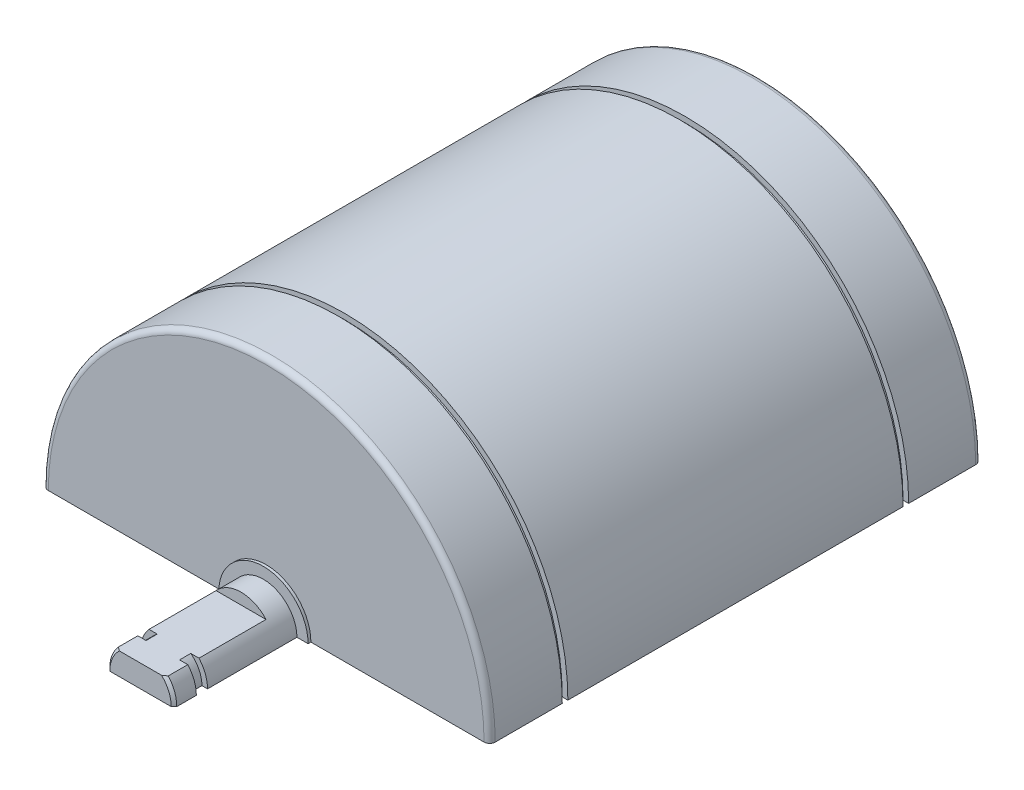
from build123d import *

# Parameters (mm, degrees)
ENL_V_MAT_EXTRU_2_DEPTH = 9
CHANFREIN1_SIZE         = 0.25
CONG_1_R                = 0.5
ESQUISSE4_R             = 10
ENL_V_MAT_EXTRU_3_DEPTH = 23
CONG_2_R                = 1
ESQUISSE5_W             = 75.40554743
ESQUISSE5_H             = 27.453522384
ENL_V_MAT_EXTRU_4_DEPTH = 30
COQUE1_START            = -43
COQUE1_DEPTH            = 42
COQUE1_START_2          = -36
COQUE1_2_DEPTH          = 28
COQUE1_START_3          = -48
COQUE1_3_DEPTH          = 5
COQUE1_4_DEPTH          = 4.5
COQUE1_START_4          = -5.5
COQUE1_5_DEPTH          = 4.5
COQUE1_START_5          = -1
COQUE1_6_DEPTH          = 8.25
COQUE1_START_6          = -43.25
COQUE1_7_DEPTH          = 0.25
COQUE1_START_7          = 7.25
COQUE1_8_DEPTH          = 3
COQUE1_9_DEPTH          = 2.25
COQUE1_10_DEPTH         = 0.25
ENL_V_START             = -10
ENL_V_MAT_EXTRU_5_DEPTH = 10
BOSS_EXTRU_1_REACH      = 58.577
BOSS_EXTRU_1_END_RADIUS = 7.5
ESQUISSE7_R             = 2.5
ESQUISSE9_R             = 2.25
ENL_V_MAT_EXTRU_6_DEPTH = 7
D_GAGEMENT_M22_D        = 2.4
BOSS_EXTRU_2_START      = 1
ESQUISSE11_R            = 2.5
ESQUISSE11_R_2          = 1.5
BOSS_EXTRU_2_DEPTH      = 1
ESQUISSE12_R            = 1.5
ESQUISSE12_R_2          = 1.2
ENL_V_MAT_EXTRU_7_DEPTH = 1


# Read off the part's stored shape, not the designer's step: Coque1
with BuildPart() as part:
    # Esquisse1 → Révolution1 (revolve)
    with BuildSketch(Plane(origin=(0, 0, 0), x_dir=(1, 0, 0), z_dir=(0, 1, 0))):
        Polygon((20, 0), (4, 0), (4, -0.25), (3, -0.25), (3, -8.25), (2.5, -8.25), (2.5, -9.25), (3, -9.25), (3, -11.25), (0, -11.25), (0, 49), (8.5, 49), (8.5, 44.25), (10, 44.25), (10, 44), (20, 44), (20, 37.5), (19.5, 37.5), (19.5, 37), (20, 37), (20, 7), (19.5, 7), (19.5, 6.5), (20, 6.5), align=None)
    revolve(axis=Axis((0, 0, 0), (0, 0, -1)))

    # Esquisse3 → Enlèv. mat.-Extru.2 (cut)
    with BuildSketch(Plane.XY.offset(11.25)):
        with BuildLine():
            Line((-2.236067977, 2), (2.236067977, 2))
            ThreePointArc((2.236067977, 2), (0, 3), (-2.236067977, 2))
        make_face()
    extrude(amount=-ENL_V_MAT_EXTRU_2_DEPTH, mode=Mode.SUBTRACT)

    # Chanfrein1
    chanfrein1_edges = [part.edges().sort_by_distance(p)[0] for p in [
        (0, -3, 11.25),
    ]]
    chamfer(chanfrein1_edges, length=CHANFREIN1_SIZE)

    # Congé1
    cong_1_edges = [part.edges().sort_by_distance(p)[0] for p in [
        (-20, 0, 0),
        (-20, 0, -44),
    ]]
    fillet(cong_1_edges, radius=CONG_1_R)

    # Esquisse4 → Enlèv. mat.-Extru.3 (cut)
    with BuildSketch(Plane(origin=(0, -29, 0), x_dir=(-1, 0, 0), z_dir=(0, 1, 0))):
        with Locations(Location((0, -22, 0), (0, 0, 270))):
            Circle(ESQUISSE4_R)
    extrude(amount=ENL_V_MAT_EXTRU_3_DEPTH, mode=Mode.SUBTRACT)

    # Congé2
    cong_2_edges = [part.edges().sort_by_distance(p)[0] for p in [
        (-0.062948247, -19.999900935, -12.000198118),
    ]]
    fillet(cong_2_edges, radius=CONG_2_R - 0.0001)  # a hair under: the kernel refuses the full size

    # Esquisse5 → Enlèv. mat.-Extru.4 (cut, symmetric)
    with BuildSketch(Plane(origin=(0, 0, 0), x_dir=(0, 0, -1), z_dir=(1, 0, 0))):
        with Locations((20.552947191, -13.726761192)):
            Rectangle(ESQUISSE5_W, ESQUISSE5_H)
    extrude(amount=ENL_V_MAT_EXTRU_4_DEPTH, both=True, mode=Mode.SUBTRACT)

    # Coque1 outline → Coque1 (cut)
    with BuildSketch(Plane.XY.offset(COQUE1_START)):
        with BuildLine():
            ThreePointArc((18.5, 0), (0, 18.5), (-18.5, 0))
            Line((-18.5, 0), (18.5, 0))
        make_face()
    extrude(amount=COQUE1_DEPTH, mode=Mode.SUBTRACT)

    # Coque1 2 outline → Coque1 2 (cut)
    with BuildSketch(Plane.XY.offset(COQUE1_START_2)):
        with BuildLine():
            Line((-19, 0), (-18.5, 0))
            ThreePointArc((-18.5, 0), (0, 18.5), (18.5, 0))
            Line((18.5, 0), (19, 0))
            ThreePointArc((19, 0), (0, 19), (-19, 0))
        make_face()
    extrude(amount=COQUE1_2_DEPTH, mode=Mode.SUBTRACT)

    # Coque1 3 outline → Coque1 3 (cut)
    with BuildSketch(Plane.XY.offset(COQUE1_START_3)):
        with BuildLine():
            ThreePointArc((7.5, 0), (0, 7.5), (-7.5, 0))
            Line((-7.5, 0), (7.5, 0))
        make_face()
    extrude(amount=COQUE1_3_DEPTH, mode=Mode.SUBTRACT)

    # Coque1 4 outline → Coque1 4 (cut)
    with BuildSketch(Plane.XY.offset(COQUE1_START)):
        with BuildLine():
            Line((-19, 0), (-18.5, 0))
            ThreePointArc((-18.5, 0), (0, 18.5), (18.5, 0))
            Line((18.5, 0), (19, 0))
            ThreePointArc((19, 0), (0, 19), (-19, 0))
        make_face()
    extrude(amount=COQUE1_4_DEPTH, mode=Mode.SUBTRACT)

    # Coque1 5 outline → Coque1 5 (cut)
    with BuildSketch(Plane.XY.offset(COQUE1_START_4)):
        with BuildLine():
            Line((-19, 0), (-18.5, 0))
            ThreePointArc((-18.5, 0), (0, 18.5), (18.5, 0))
            Line((18.5, 0), (19, 0))
            ThreePointArc((19, 0), (0, 19), (-19, 0))
        make_face()
    extrude(amount=COQUE1_5_DEPTH, mode=Mode.SUBTRACT)

    # Coque1 6 outline → Coque1 6 (cut)
    with BuildSketch(Plane.XY.offset(COQUE1_START_5)):
        with BuildLine():
            ThreePointArc((-1.732050808, 1), (-1.931851653, 0.51763809), (-2, 0))
            Line((-2, 0), (2, 0))
            ThreePointArc((2, 0), (1.931851653, 0.51763809), (1.732050808, 1))
            Line((1.732050808, 1), (-1.732050808, 1))
        make_face()
    extrude(amount=COQUE1_6_DEPTH, mode=Mode.SUBTRACT)

    # Coque1 7 outline → Coque1 7 (cut)
    with BuildSketch(Plane.XY.offset(COQUE1_START_6)):
        with BuildLine():
            Line((-9, 0), (-7.5, 0))
            ThreePointArc((-7.5, 0), (0, 7.5), (7.5, 0))
            Line((7.5, 0), (9, 0))
            ThreePointArc((9, 0), (0, 9), (-9, 0))
        make_face()
    extrude(amount=COQUE1_7_DEPTH, mode=Mode.SUBTRACT)

    # Coque1 8 outline → Coque1 8 (cut)
    with BuildSketch(Plane.XY.offset(COQUE1_START_7)):
        with BuildLine():
            Line((1.118033989, 1), (-1.118033989, 1))
            ThreePointArc((-1.118033989, 1), (-1.401258538, 0.535233134), (-1.5, 0))
            Line((-1.5, 0), (1.5, 0))
            ThreePointArc((1.5, 0), (1.401258538, 0.535233134), (1.118033989, 1))
        make_face()
    extrude(amount=COQUE1_8_DEPTH, mode=Mode.SUBTRACT)

    # Coque1 9 outline → Coque1 9 (cut)
    with BuildSketch(Plane.XY.offset(COQUE1_START_5)):
        with BuildLine():
            Line((-1.732050808, 1), (1.732050808, 1))
            ThreePointArc((1.732050808, 1), (0, 2), (-1.732050808, 1))
        make_face()
    extrude(amount=COQUE1_9_DEPTH, mode=Mode.SUBTRACT)

    # Coque1 10 outline → Coque1 10 (cut)
    with BuildSketch(Plane.XY.offset(COQUE1_START_5)):
        with BuildLine():
            ThreePointArc((-2, 0), (0, 2), (2, 0))
            Line((2, 0), (3, 0))
            ThreePointArc((3, 0), (0, 3), (-3, 0))
            Line((-3, 0), (-2, 0))
        make_face()
    extrude(amount=COQUE1_10_DEPTH, mode=Mode.SUBTRACT)

    # Esquisse6 → Enlèv. mat.-Extru.5 (cut)
    with BuildSketch(Plane.XY.offset(-48).offset(ENL_V_START)):
        with BuildLine():
            Line((-7.5, 0), (7.5, 0))
            ThreePointArc((7.5, 0), (0, 7.5), (-7.5, 0))
        make_face()
    extrude(amount=ENL_V_MAT_EXTRU_5_DEPTH, mode=Mode.SUBTRACT)

    # Boss.-Extru.1: up to this cylinder (the profile starts inside it)
    boss_extru_1_end = Plane(origin=(0, 0, -46.5), z_dir=(0, 0, 1)) * Cylinder(BOSS_EXTRU_1_END_RADIUS, 133.154, mode=Mode.PRIVATE)
    # Esquisse7 → Boss.-Extru.1 (add, up to the surface)
    with BuildSketch(Plane(origin=(0, 0, 0), x_dir=(1, 0, 0), z_dir=(0, 1, 0)), mode=Mode.PRIVATE) as boss_extru_1_sk1:
        with Locations(Location((1.5, 46.5, 0), (0, 0, 90))):
            Circle(ESQUISSE7_R)
    boss_extru_1_tool1 = extrude(boss_extru_1_sk1.sketch, amount=BOSS_EXTRU_1_REACH, mode=Mode.PRIVATE) & boss_extru_1_end
    add(boss_extru_1_tool1.solids().sort_by_distance((1.5, 0, -46.5))[0])

    # Esquisse9 → Enlèv. mat.-Extru.6 (cut)
    with BuildSketch(Plane.XZ.offset(-11)):
        with Locations(Location((1.5, -46.5, 0), (0, 0, 90))):
            Circle(ESQUISSE9_R)
    extrude(amount=ENL_V_MAT_EXTRU_6_DEPTH, mode=Mode.SUBTRACT)

    # Dégagement M22 (through all)
    with Locations(Plane(origin=(1.5, 0, -46.5), x_dir=(0, 0, -1), z_dir=(0, -1, 0))):
        with Locations((0, 0)):
            Hole(D_GAGEMENT_M22_D / 2)

    # Esquisse11 → Boss.-Extru.2 (add)
    with BuildSketch(Plane.XZ.offset(BOSS_EXTRU_2_START)):
        with Locations(Location((1.5, -46.5, 0), (0, 0, 270))):
            Circle(ESQUISSE11_R)
        with Locations(Location((1.5, -46.5, 0), (0, 0, 270))):
            Circle(ESQUISSE11_R_2, mode=Mode.SUBTRACT)
    extrude(amount=-BOSS_EXTRU_2_DEPTH)

    # Esquisse12 → Enlèv. mat.-Extru.7 (cut)
    with BuildSketch(Plane.XZ):
        with Locations(Location((1.5, -46.5, 0), (0, 0, 270))):
            Circle(ESQUISSE12_R)
        with Locations(Location((1.5, -46.5, 0), (0, 0, 270))):
            Circle(ESQUISSE12_R_2, mode=Mode.SUBTRACT)
    extrude(amount=-ENL_V_MAT_EXTRU_7_DEPTH, mode=Mode.SUBTRACT)


solid = part.part
